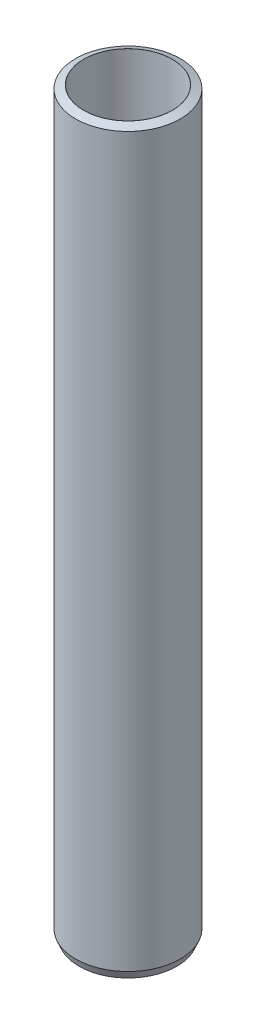
from build123d import *
from OCP.BRepFilletAPI import BRepFilletAPI_MakeChamfer

# Parameters (mm, degrees)
SKETCH1_R           = 42.5
BOSS_EXTRUDE1_DEPTH = 600
SKETCH2_R           = 35.927155387
CUT_EXTRUDE1_DEPTH  = 604.002902149
CHAMFER1_SIZE       = 2.76386325
CHAMFER1_SIZE2      = 6.508560647


with BuildPart() as part:
    # Sketch1 → Boss-Extrude1 (new body)
    with BuildSketch(Plane(origin=(0, 0, 0), x_dir=(1, 0, 0), z_dir=(0, 1, 0))):
        Circle(SKETCH1_R)
    extrude(amount=BOSS_EXTRUDE1_DEPTH)

    # Sketch2 → Cut-Extrude1 (cut, through all)
    with BuildSketch(Plane(origin=(0, 0, 0), x_dir=(1, 0, 0), z_dir=(0, 1, 0))):
        Circle(SKETCH2_R)
    extrude(amount=CUT_EXTRUDE1_DEPTH, mode=Mode.SUBTRACT)

    # Chamfer1: one chamfer whose edges measure the first distance from different faces: ONE call of the kernel's chamfer builder (chamfer() names one face for all edges)
    chamfer1_edges_1 = [part.edges().sort_by_distance(p)[0] for p in [
        (-42.5, 600, 0),
    ]]
    chamfer1_side_1 = [part.faces().sort_by_distance(p)[0] for p in [
        (-42.5, 300, 0),
    ]]
    chamfer1_edges_2 = [part.edges().sort_by_distance(p)[0] for p in [
        (-42.5, 0, 0),
    ]]
    chamfer1_side_2 = [part.faces().sort_by_distance(p)[0] for p in [
        (-41.297918472, 0, 0),
    ]]
    chamfer1 = BRepFilletAPI_MakeChamfer(part.part.solid().wrapped)
    for e in chamfer1_edges_1:
        chamfer1.Add(CHAMFER1_SIZE, CHAMFER1_SIZE2, e.wrapped, chamfer1_side_1[0].wrapped)  # the first distance lies on this face
    for e in chamfer1_edges_2:
        chamfer1.Add(CHAMFER1_SIZE, CHAMFER1_SIZE2, e.wrapped, chamfer1_side_2[0].wrapped)  # the first distance lies on this face
    add(Compound.cast(chamfer1.Shape()), mode=Mode.REPLACE)


solid = part.part
